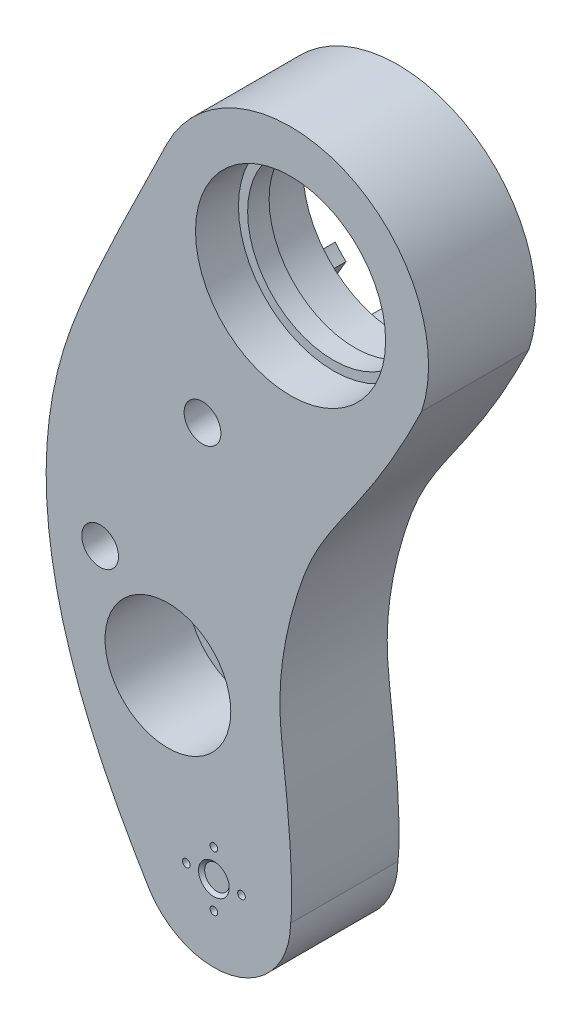
from build123d import *

# Parameters (mm, degrees)
SKIZZE1_R                        = 9
SKIZZE1_R_2                      = 28
AUFSATZ_LINEAR_AUSTRAGEN1_DEPTH  = 35
SKIZZE2_R                        = 4
SCHNITT_LINEAR_AUSTRAGEN1_DEPTH  = 1
FASE1_SIZE                       = 1
SKIZZE4_R                        = 1.25
SCHNITT_LINEAR_AUSTRAGEN2_DEPTH  = 15
SKIZZE5_R                        = 1.25
SCHNITT_LINEAR_AUSTRAGEN3_DEPTH  = 15
SKIZZE6_R                        = 12.5
SCHNITT_LINEAR_AUSTRAGEN4_DEPTH  = 35
SKIZZE7_R                        = 20.5
SCHNITT_LINEAR_AUSTRAGEN5_DEPTH  = 27
SKIZZE8_R                        = 2
SCHNITT_LINEAR_AUSTRAGEN6_DEPTH  = 15
SKIZZE9_R                        = 3.5
SCHNITT_LINEAR_AUSTRAGEN7_DEPTH  = 4
SKIZZE10_R                       = 31
SCHNITT_LINEAR_AUSTRAGEN8_DEPTH  = 14
SKIZZE11_R                       = 1.65
SCHNITT_LINEAR_AUSTRAGEN10_DEPTH = 15
SKIZZE12_R                       = 2.1
SCHNITT_LINEAR_AUSTRAGEN11_DEPTH = 15
BOSS_EXTRUDE1_DEPTH              = 5
SKETCH2_R                        = 6
CUT_EXTRUDE1_DEPTH               = 35
CUT_EXTRUDE2_START               = 8
SKETCH3_R                        = 6
CUT_EXTRUDE2_DEPTH               = 8
CUT_EXTRUDE3_START               = -10
SKETCH4_R                        = 6
CUT_EXTRUDE3_DEPTH               = 10
SKIZZE13_R                       = 1.65
SCHNITT_LINEAR_AUSTRAGEN12_DEPTH = 15


with BuildPart() as part:
    # Skizze1 → Aufsatz-Linear austragen1 (new body)
    # profile 1 of 4: a face of its own
    with BuildSketch(Plane.XY):
        with BuildLine():
            add(Edge.make_bspline(
                [(-21.90615173, -12.046597711), (-21.575742026, -12.598438537), (-21.248020936, -13.143822016), (-20.923299769, -13.682672501)],
                knots=[0.9859462, 0.9859462, 0.9859462, 0.9859462, 1, 1, 1, 1], degree=3))
            ThreePointArc((-20.923299769, -13.682672501), (7.138539969, -23.959157897), (25, 0))
            ThreePointArc((25, 0), (-6.218770247, 24.21418792), (-21.90615173, -12.046597711))
        make_face()
        Circle(SKIZZE1_R, mode=Mode.SUBTRACT)
    # profile 2 of 4: a face of its own
    with BuildSketch(Plane.XY):
        Circle(SKIZZE1_R)
    # profile 3 of 4: a face of its own
    with BuildSketch(Plane.XY):
        with BuildLine():
            ThreePointArc((-21.90615173, -12.046597711), (-6.218770247, 24.21418792), (25, 0))
            add(Edge.make_bspline(
                [(61.420827626, 153.570408345), (47.913273557, 128.743473036), (35.386108163, 117.222864261), (25.006140509, 88.46764169), (20.036125276, 66.269671918), (25.663716119, 21.50596296), (25.709290114, 4.90404347), (25, 0)],
                knots=[0.045529733, 0.045529733, 0.045529733, 0.045529733, 0.347734035, 0.409134766, 0.591243699, 0.652606584, 1, 1, 1, 1], degree=3))
            ThreePointArc((61.420827626, 153.570408345), (1.91364242, 141.373324067), (-15.526505959, 199.560222769))
            add(Edge.make_bspline(
                [(-15.526505959, 199.560222769), (-37.33502728, 155.24670183), (-72.898560815, 80.515220187), (-39.634443124, 17.562686966), (-21.90615173, -12.046597711)],
                knots=[0.001075204, 0.001075204, 0.001075204, 0.001075204, 0.231882812, 0.9859462, 0.9859462, 0.9859462, 0.9859462], degree=3))
        make_face()
    # profile 4 of 4: a face of its own
    with BuildSketch(Plane.XY):
        with BuildLine():
            ThreePointArc((-15.526505959, 199.560222769), (1.91364242, 141.373324067), (61.420827626, 153.570408345))
            add(Edge.make_bspline(
                [(67.734061127, 165.90035392), (65.561159832, 161.397385892), (63.455859297, 157.310804229), (61.420827626, 153.570408345)],
                knots=[0, 0, 0, 0, 0.045529733, 0.045529733, 0.045529733, 0.045529733], degree=3))
            ThreePointArc((67.734061127, 165.90035392), (69.429904067, 172.859718168), (70, 180))
            ThreePointArc((70, 180), (35.369713301, 223.788914648), (-15.220846491, 200.181266251))
            add(Edge.make_bspline(
                [(-15.220846491, 200.181266251), (-15.323026036, 199.973668406), (-15.424912199, 199.766654794), (-15.526505959, 199.560222769)],
                knots=[0, 0, 0, 0, 0.001075204, 0.001075204, 0.001075204, 0.001075204], degree=3))
        make_face()
        with Locations((25, 180)):
            Circle(SKIZZE1_R_2, mode=Mode.SUBTRACT)
    extrude(amount=AUFSATZ_LINEAR_AUSTRAGEN1_DEPTH)

    # Skizze2 → Schnitt-Linear austragen1 (cut)
    with BuildSketch(Plane.XY.offset(35)):
        Circle(SKIZZE2_R)
    extrude(amount=-SCHNITT_LINEAR_AUSTRAGEN1_DEPTH, mode=Mode.SUBTRACT)

    # Fase1
    fase1_edges = [part.edges().sort_by_distance(p)[0] for p in [
        (-4, 0, 35),
    ]]
    chamfer(fase1_edges, length=FASE1_SIZE - 0.0001)  # a hair under: the kernel refuses the full size

    # Skizze4 → Schnitt-Linear austragen2 (cut)
    with BuildSketch(Plane.XY.offset(35)):
        with Locations((0, 9)):
            Circle(SKIZZE4_R)
        with Locations((9, 0)):
            Circle(SKIZZE4_R)
        with Locations((0, -9)):
            Circle(SKIZZE4_R)
        with Locations((-9, 0)):
            Circle(SKIZZE4_R)
    extrude(amount=-SCHNITT_LINEAR_AUSTRAGEN2_DEPTH, mode=Mode.SUBTRACT)

    # Skizze5 → Schnitt-Linear austragen3 (cut)
    with BuildSketch(Plane(origin=(0, 0, 0), x_dir=(-1, 0, 0), z_dir=(0, 0, -1))):
        with Locations((8, 0)):
            Circle(SKIZZE5_R)
        with Locations((0, -8)):
            Circle(SKIZZE5_R)
        with Locations((-8, 0)):
            Circle(SKIZZE5_R)
        with Locations((0, 8)):
            Circle(SKIZZE5_R)
    extrude(amount=-SCHNITT_LINEAR_AUSTRAGEN3_DEPTH, mode=Mode.SUBTRACT)

    # Skizze6 → Schnitt-Linear austragen4 (cut)
    with BuildSketch(Plane.XY.offset(35)):
        with Locations((-15, 50)):
            Circle(SKIZZE6_R)
    extrude(amount=-SCHNITT_LINEAR_AUSTRAGEN4_DEPTH, mode=Mode.SUBTRACT)

    # Skizze7 → Schnitt-Linear austragen5 (cut)
    with BuildSketch(Plane.XY.offset(35)):
        with Locations((-15, 50)):
            Circle(SKIZZE7_R)
    extrude(amount=-SCHNITT_LINEAR_AUSTRAGEN5_DEPTH, mode=Mode.SUBTRACT)

    # Skizze8 → Schnitt-Linear austragen6 (cut)
    with BuildSketch(Plane.XY.offset(8)):
        with Locations((2.46462713, 51.112114754)):
            Circle(SKIZZE8_R)
        with Locations((-16.112114754, 67.46462713)):
            Circle(SKIZZE8_R)
        with Locations((-13.887885246, 32.53537287)):
            Circle(SKIZZE8_R)
        with Locations((-32.46462713, 48.887885246)):
            Circle(SKIZZE8_R)
    extrude(amount=-SCHNITT_LINEAR_AUSTRAGEN6_DEPTH, mode=Mode.SUBTRACT)

    # Skizze9 → Schnitt-Linear austragen7 (cut)
    with BuildSketch(Plane(origin=(0, 0, 0), x_dir=(-1, 0, 0), z_dir=(0, 0, -1))):
        with Locations((13.887885246, 32.53537287)):
            Circle(SKIZZE9_R)
        with Locations((-2.46462713, 51.112114754)):
            Circle(SKIZZE9_R)
        with Locations((16.112114754, 67.46462713)):
            Circle(SKIZZE9_R)
        with Locations((32.46462713, 48.887885246)):
            Circle(SKIZZE9_R)
    extrude(amount=-SCHNITT_LINEAR_AUSTRAGEN7_DEPTH, mode=Mode.SUBTRACT)

    # Skizze10 → Schnitt-Linear austragen8 (cut)
    with BuildSketch(Plane.XY.offset(35)):
        with Locations((25, 180)):
            Circle(SKIZZE10_R)
    schnitt_linear_austragen8 = extrude(amount=-SCHNITT_LINEAR_AUSTRAGEN8_DEPTH, mode=Mode.SUBTRACT)

    # Spiegeln1: Schnitt-Linear austragen8 across plane
    add(schnitt_linear_austragen8.mirror(Plane.XY.offset(17.5)), mode=Mode.SUBTRACT)

    # Skizze11 → Schnitt-Linear austragen10 (cut)
    with BuildSketch(Plane.XY):
        with Locations((12.868875195, 101.386680064)):
            Circle(SKIZZE11_R)
    extrude(amount=SCHNITT_LINEAR_AUSTRAGEN10_DEPTH, mode=Mode.SUBTRACT)

    # Skizze12 → Schnitt-Linear austragen11 (cut)
    with BuildSketch(Plane(origin=(0, 0, 0), x_dir=(-1, 0, 0), z_dir=(0, 0, -1))):
        with Locations((-2, 140)):
            Circle(SKIZZE12_R)
    extrude(amount=-SCHNITT_LINEAR_AUSTRAGEN11_DEPTH, mode=Mode.SUBTRACT)

    # Sketch1 → Boss-Extrude1 (add)
    with BuildSketch(Plane(origin=(0, 0, 0), x_dir=(-1, 0, 0), z_dir=(0, 0, -1))):
        with BuildLine():
            Line((-8.068344121, 136.51070213), (-15.214181441, 148.938245296))
            ThreePointArc((-15.214181441, 148.938245296), (-18.014496555, 148.191234041), (-20.870136061, 147.696144595))
            Line((-20.870136061, 147.696144595), (-8.068344121, 136.51070213))
        make_face()
        with BuildLine():
            ThreePointArc((0.443638721, 159.672282499), (-1.242605981, 157.724877562), (-3.077493199, 155.916841035))
            Line((-3.077493199, 155.916841035), (4.052249922, 143.517287782))
            Line((4.052249922, 143.517287782), (0.443638721, 159.672282499))
        make_face()
    extrude(amount=BOSS_EXTRUDE1_DEPTH)

    # Sketch2 → Cut-Extrude1 (cut)
    with BuildSketch(Plane(origin=(0, 0, 0), x_dir=(-1, 0, 0), z_dir=(0, 0, -1))):
        with Locations((3.710410677, 126.992836719)):
            Circle(SKETCH2_R)
    extrude(amount=-CUT_EXTRUDE1_DEPTH, mode=Mode.SUBTRACT)

    # Sketch3 → Cut-Extrude2 (cut)
    with BuildSketch(Plane(origin=(0, 0, 17.5), x_dir=(-1, 0, 0), z_dir=(0, 0, -1)).offset(CUT_EXTRUDE2_START)):
        with BuildLine():
            ThreePointArc((32.070234604, 72.232513918), (33.839840892, 80.53121825), (42.138545224, 78.761611961))
            Line((42.138545224, 78.761611961), (8.744565987, 130.257385741))
            ThreePointArc((8.744565987, 130.257385741), (9.463884926, 128.69505118), (9.710410677, 126.992836719))
            ThreePointArc((9.710410677, 126.992836719), (5.412625137, 121.23936247), (-1.323744633, 123.728287698))
            Line((-1.323744633, 123.728287698), (32.070234604, 72.232513918))
        make_face()
        with Locations((37.104389914, 75.497062939)):
            Circle(SKETCH3_R)
    extrude(amount=-CUT_EXTRUDE2_DEPTH, mode=Mode.SUBTRACT)

    # Sketch4 → Cut-Extrude3 (cut)
    with BuildSketch(Plane.XY.offset(35).offset(CUT_EXTRUDE3_START)):
        with Locations((-37.104389914, 75.497062939)):
            Circle(SKETCH4_R)
    extrude(amount=CUT_EXTRUDE3_DEPTH, mode=Mode.SUBTRACT)

    # Skizze13 → Schnitt-Linear austragen12 (cut)
    with BuildSketch(Plane(origin=(0, 0, 0), x_dir=(-1, 0, 0), z_dir=(0, 0, -1))):
        with Locations((-56.574321758, 156.900214998)):
            Circle(SKIZZE13_R)
        with Locations((6.898947223, 202.392758189)):
            Circle(SKIZZE13_R)
        with Locations((39.561746336, 32.359075962)):
            Circle(SKIZZE13_R)
        with Locations((-16.081803595, 52.359670818)):
            Circle(SKIZZE13_R)
    extrude(amount=-SCHNITT_LINEAR_AUSTRAGEN12_DEPTH, mode=Mode.SUBTRACT)


solid = part.part
